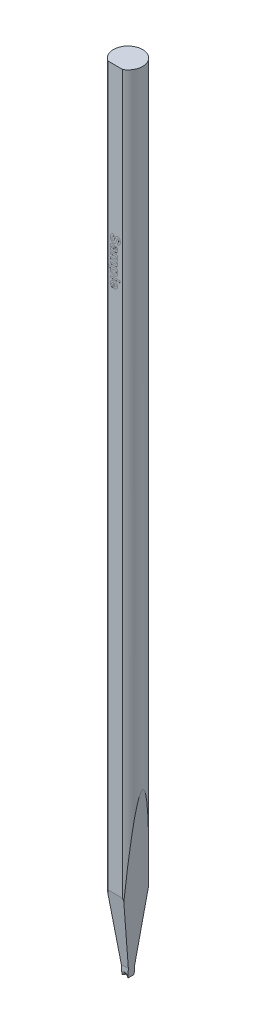
from build123d import *

# Parameters (mm, degrees)
SKETCH_TL_CUTTING_R       = 1.4986
TL_CUTTING_DEPTH          = 81.28
SKETCH_TDF_GRINDING_W     = 3.0172
SKETCH_TDF_GRINDING_H     = 3.0172
TDF_GRINDING_DEPTH        = 82.307625743
SKETCH_ENGRAVING_W        = 1
SKETCH_ENGRAVING_H        = 0.192307692
ENGRAVING_DEPTH           = 0.005
VW_VR_GRINDING_DEPTH      = 1.5086
VW_VR_GRINDING_DEPTH_BACK = 1.5086
ISA_GRINDING_DEPTH        = 1.5086
ISA_GRINDING_DEPTH_BACK   = 1.5086
PRE_FRX_BRX_DEPTH         = 1.5086
PRE_FRX_BRX_DEPTH_BACK    = 1.5086
SKETCH_PRE_FRX_BRX_W      = 1.18348
SKETCH_PRE_FRX_BRX_H      = 0.889
FR_EDM_R                  = 0.22606
BR_EDM_R                  = 0.22606
FA_BA_GRINDING_DEPTH      = 1.5086
FA_BA_GRINDING_DEPTH_BACK = 1.5086


with BuildPart() as part:
    # sketch_TL_cutting → TL_cutting (new body)
    with BuildSketch(Plane(origin=(0, 0, 0), x_dir=(1, 0, 0), z_dir=(0, 1, 0))):
        Circle(SKETCH_TL_CUTTING_R)
    extrude(amount=TL_CUTTING_DEPTH)

    # sketch_TDF_grinding → TDF_grinding (cut, through all)
    with BuildSketch(Plane(origin=(0, 0, 0), x_dir=(1, 0, 0), z_dir=(0, 1, 0))):
        with Locations((0, -2.804)):
            Rectangle(SKETCH_TDF_GRINDING_W, SKETCH_TDF_GRINDING_H)
    extrude(amount=TDF_GRINDING_DEPTH, mode=Mode.SUBTRACT)

    # sketch_engraving → engraving (cut)
    # profile 1 of 6: a face of its own
    with BuildSketch(Plane.XY.offset(1.2954)):
        with BuildLine():
            Line((-0.166666667, 66.228717949), (-0.153846154, 66.036410256))
            add(Edge.make_bspline(
                [(-0.153846154, 66.036410256), (-0.161891279, 66.034877607), (-0.177518424, 66.031900534), (-0.199795017, 66.025296625), (-0.220541784, 66.017990456), (-0.239662803, 66.009377579), (-0.25710555, 65.999512511), (-0.273156714, 65.988722233), (-0.28732832, 65.976479477), (-0.299925293, 65.963147792), (-0.310783278, 65.948574614), (-0.320246275, 65.932874014), (-0.328256178, 65.915952746), (-0.334922245, 65.897875434), (-0.339885492, 65.878462022), (-0.343420115, 65.857894378), (-0.345682646, 65.836139377), (-0.345994208, 65.821271711), (-0.346153846, 65.813653846)],
                knots=[0, 0, 0, 0, 1.20477517, 2.340199137, 3.415898527, 4.440826703, 5.422227366, 6.362763262, 7.28278988, 8.172822029, 9.057410505, 9.952475558, 10.866920142, 11.809098, 12.784128911, 13.811833846, 14.878831738, 16, 16, 16, 16], degree=3))
            add(Edge.make_bspline(
                [(-0.346153846, 65.813653846), (-0.346066367, 65.805635548), (-0.345896216, 65.790039545), (-0.343785338, 65.767439212), (-0.340761278, 65.746306874), (-0.335974263, 65.726829137), (-0.330620744, 65.708642273), (-0.323296559, 65.692197968), (-0.314849171, 65.677230114), (-0.305263574, 65.663777272), (-0.294632459, 65.652036964), (-0.28353392, 65.641765956), (-0.272207737, 65.632820587), (-0.260151301, 65.625779949), (-0.247852227, 65.620082055), (-0.234943611, 65.616316145), (-0.221721863, 65.613772051), (-0.212685699, 65.613480317), (-0.208133013, 65.613333333)],
                knots=[0, 0, 0, 0, 1.417779877, 2.757654889, 4.012140507, 5.189587551, 6.302846416, 7.360586765, 8.365575446, 9.33904572, 10.275781718, 11.161696098, 12.012180333, 12.822428111, 13.625933072, 14.403138519, 15.195454004, 16, 16, 16, 16], degree=3))
            add(Edge.make_bspline(
                [(-0.208133013, 65.613333333), (-0.202439146, 65.613627611), (-0.191320796, 65.614202244), (-0.175220679, 65.617972543), (-0.160658688, 65.624777047), (-0.147071392, 65.634013587), (-0.134926522, 65.646977985), (-0.123459543, 65.663382139), (-0.11316916, 65.683841853), (-0.107424402, 65.699010458), (-0.104366987, 65.707083333)],
                knots=[0, 0, 0, 0, 0.906150226, 1.7694295, 2.610923838, 3.450874087, 4.367551936, 5.419872502, 6.626831617, 8, 8, 8, 8], degree=3))
            add(Edge.make_bspline(
                [(-0.104366987, 65.707083333), (-0.103205903, 65.710547521), (-0.100607587, 65.718299809), (-0.096897182, 65.731525769), (-0.092218385, 65.747511172), (-0.087052561, 65.766404594), (-0.081545375, 65.7881675), (-0.074955523, 65.812593148), (-0.068334023, 65.840052448), (-0.063456004, 65.85926551), (-0.060897436, 65.869342949)],
                knots=[0, 0, 0, 0, 0.521824192, 1.167757792, 1.961731518, 2.901193269, 3.965386864, 5.168422915, 6.514810244, 8, 8, 8, 8], degree=3))
            add(Edge.make_bspline(
                [(-0.060897436, 65.869342949), (-0.0576208, 65.882466465), (-0.051299067, 65.907786143), (-0.040053153, 65.943897802), (-0.028879714, 65.9771573), (-0.016755933, 66.007244403), (-0.004503472, 66.034490983), (0.008737874, 66.058456319), (0.022280434, 66.079640515), (0.032402475, 66.091985038), (0.037259615, 66.097908654)],
                knots=[0, 0, 0, 0, 1.293880989, 2.496331788, 3.617634808, 4.64976062, 5.598842568, 6.473791081, 7.267636666, 8, 8, 8, 8], degree=3))
            add(Edge.make_bspline(
                [(0.037259615, 66.097908654), (0.044137694, 66.105254708), (0.057622804, 66.119657326), (0.079781426, 66.138616137), (0.103188466, 66.154546701), (0.127671148, 66.1676593), (0.153370416, 66.177755752), (0.180114252, 66.184911988), (0.207972454, 66.189543764), (0.22694455, 66.190016405), (0.236578526, 66.19025641)],
                knots=[0, 0, 0, 0, 1.064429417, 2.086912298, 3.078678339, 4.055528992, 5.020032834, 5.993708893, 6.981211098, 8, 8, 8, 8], degree=3))
            add(Edge.make_bspline(
                [(0.236578526, 66.19025641), (0.249044725, 66.189788947), (0.273773943, 66.188861639), (0.310123415, 66.180359285), (0.34519423, 66.167110895), (0.373053378, 66.151758506), (0.394102454, 66.136979981), (0.409316468, 66.124753329), (0.423234984, 66.111063515), (0.436363342, 66.096402084), (0.448421192, 66.080522948), (0.459337354, 66.063406575), (0.469762031, 66.04537482), (0.481724432, 66.019062443), (0.494501972, 65.983531575), (0.505216674, 65.937296526), (0.511620444, 65.886950752), (0.512410831, 65.852001491), (0.512820513, 65.833886218)],
                knots=[0, 0, 0, 0, 1.180224575, 2.341213254, 3.519178081, 4.726056898, 5.344182394, 5.956118988, 6.573855441, 7.192564044, 7.82049682, 8.461345463, 9.116141012, 9.79299132, 11.198532007, 12.687823846, 14.283197644, 16, 16, 16, 16], degree=3))
            add(Edge.make_bspline(
                [(0.512820513, 65.833886218), (0.512622915, 65.819053184), (0.512238592, 65.79020325), (0.508327094, 65.748385277), (0.502300976, 65.709376936), (0.493471523, 65.67324209), (0.482080613, 65.639912702), (0.468307987, 65.609323819), (0.4520288, 65.58155582), (0.433078398, 65.556903847), (0.412189308, 65.534940609), (0.389371716, 65.515781372), (0.364914548, 65.49935264), (0.338835479, 65.485548448), (0.311000478, 65.47470805), (0.281444264, 65.466746206), (0.250236407, 65.461480173), (0.228852471, 65.460160226), (0.217948718, 65.459487179)],
                knots=[0, 0, 0, 0, 1.325136797, 2.577362738, 3.74962816, 4.849499017, 5.896771726, 6.892816139, 7.842473141, 8.766187929, 9.665133525, 10.546015357, 11.42313021, 12.293255665, 13.177485873, 14.086514152, 15.024305989, 16, 16, 16, 16], degree=3))
            Line((0.217948718, 65.459487179), (0.205128205, 65.651794872))
            add(Edge.make_bspline(
                [(0.205128205, 65.651794872), (0.211158714, 65.652903797), (0.22291155, 65.655064976), (0.239739753, 65.659772083), (0.255319488, 65.66505285), (0.269550394, 65.67131916), (0.282452554, 65.678537492), (0.29405422, 65.686741672), (0.304442868, 65.695777543), (0.313348905, 65.706026012), (0.321255295, 65.717250185), (0.327770309, 65.729876673), (0.333732615, 65.7435148), (0.338229411, 65.758675772), (0.341791978, 65.775084625), (0.344434282, 65.792746154), (0.34572413, 65.811698367), (0.346007328, 65.824736733), (0.346153846, 65.831482372)],
                knots=[0, 0, 0, 0, 1.150775252, 2.242741279, 3.277646382, 4.23752694, 5.158201782, 6.048759188, 6.901533576, 7.736611693, 8.592238639, 9.472855288, 10.399741491, 11.383322377, 12.435924598, 13.551250831, 14.733094547, 16, 16, 16, 16], degree=3))
            add(Edge.make_bspline(
                [(0.346153846, 65.831482372), (0.346024502, 65.838495999), (0.345772856, 65.852141324), (0.344228543, 65.8720262), (0.34137789, 65.890679706), (0.337667048, 65.908193454), (0.332618703, 65.924544049), (0.326463073, 65.939696989), (0.319216002, 65.953721597), (0.313514257, 65.962273191), (0.310697115, 65.966498397)],
                knots=[0, 0, 0, 0, 1.186678824, 2.308736671, 3.37120409, 4.377216403, 5.334874112, 6.262130804, 7.141346615, 8, 8, 8, 8], degree=3))
            add(Edge.make_bspline(
                [(0.310697115, 65.966498397), (0.30684882, 65.971333791), (0.299395868, 65.980698448), (0.284596838, 65.9907768), (0.267881777, 65.996843991), (0.256061421, 65.997574247), (0.25, 65.997948718)],
                knots=[0, 0, 0, 0, 1.037857257, 2.010007357, 2.979541333, 4, 4, 4, 4], degree=3))
            add(Edge.make_bspline(
                [(0.25, 65.997948718), (0.244335199, 65.997642469), (0.233176443, 65.997039206), (0.217325189, 65.990954527), (0.202637862, 65.98159712), (0.194659513, 65.972854158), (0.190504808, 65.968301282)],
                knots=[0, 0, 0, 0, 0.98538058, 1.941042925, 2.927803204, 4, 4, 4, 4], degree=3))
            add(Edge.make_bspline(
                [(0.190504808, 65.968301282), (0.187808196, 65.964687988), (0.18178239, 65.956613781), (0.17412302, 65.941823434), (0.165827461, 65.923971096), (0.157717635, 65.902649778), (0.149622864, 65.878001181), (0.141170987, 65.850023806), (0.132605635, 65.818700446), (0.124310512, 65.784829517), (0.116156882, 65.750440984), (0.107242663, 65.717624955), (0.098551989, 65.687110767), (0.089442753, 65.659039906), (0.080574939, 65.633267671), (0.071467056, 65.609919256), (0.062596997, 65.58883434), (0.050400038, 65.564246991), (0.033878763, 65.536379703), (0.009862335, 65.507171642), (-0.017133698, 65.48134084), (-0.042589095, 65.463342623), (-0.064481415, 65.450978789), (-0.081932142, 65.443017785), (-0.100320809, 65.436130892), (-0.119667735, 65.43052498), (-0.140000145, 65.426462043), (-0.161162698, 65.423099726), (-0.183331155, 65.421381856), (-0.198448465, 65.421145657), (-0.206129808, 65.421025641)],
                knots=[0, 0, 0, 0, 0.511875881, 1.143829537, 1.88775736, 2.750598373, 3.734912702, 4.837306479, 6.073130119, 7.42648979, 8.801963576, 10.091065733, 11.292408984, 12.408830014, 13.446061236, 14.39066453, 15.257936293, 16.045629259, 17.510392066, 18.929669597, 20.331293837, 21.746891395, 22.460690638, 23.187651344, 23.925159671, 24.69163991, 25.474819891, 26.281170188, 27.126635539, 28, 28, 28, 28], degree=3))
            add(Edge.make_bspline(
                [(-0.206129808, 65.421025641), (-0.213213723, 65.421190667), (-0.227281693, 65.421518393), (-0.248162112, 65.42380863), (-0.268671734, 65.427350423), (-0.288836268, 65.432593495), (-0.308616053, 65.439548961), (-0.328296541, 65.447380279), (-0.347448635, 65.45717284), (-0.366087841, 65.468318337), (-0.384201522, 65.48061148), (-0.400907086, 65.494545053), (-0.416780552, 65.509286381), (-0.430830184, 65.525791492), (-0.444499814, 65.542874729), (-0.456413626, 65.561651015), (-0.467267368, 65.581519569), (-0.476944445, 65.602661493), (-0.485241283, 65.625146826), (-0.492760445, 65.648840495), (-0.498861937, 65.67396603), (-0.504102567, 65.700352968), (-0.508085093, 65.728103742), (-0.510866581, 65.757181988), (-0.512434986, 65.787594789), (-0.512690407, 65.80831022), (-0.512820513, 65.818862179)],
                knots=[0, 0, 0, 0, 0.900523777, 1.788352984, 2.667658312, 3.544829998, 4.433470602, 5.332071549, 6.235671317, 7.16456001, 8.092361829, 9.015217829, 9.927983376, 10.842405559, 11.767913001, 12.707486241, 13.664840466, 14.644960138, 15.660436429, 16.710285012, 17.80361473, 18.945755434, 20.129541241, 21.366238063, 22.658422763, 24, 24, 24, 24], degree=3))
            add(Edge.make_bspline(
                [(-0.512820513, 65.818862179), (-0.512571769, 65.834097584), (-0.512087459, 65.863761277), (-0.507752501, 65.906857296), (-0.501117535, 65.947278506), (-0.491487967, 65.98495912), (-0.47912575, 66.019945132), (-0.463898318, 66.052220803), (-0.445714308, 66.081629249), (-0.4250161, 66.108537493), (-0.401421388, 66.132576838), (-0.37543806, 66.154222472), (-0.346733609, 66.173055309), (-0.315676999, 66.189585327), (-0.28185988, 66.203074186), (-0.245840091, 66.214602175), (-0.207125792, 66.223178959), (-0.180386288, 66.226839687), (-0.166666667, 66.228717949)],
                knots=[0, 0, 0, 0, 1.217919187, 2.371317543, 3.459749122, 4.490553404, 5.476795534, 6.422548752, 7.338285933, 8.236452553, 9.131296239, 10.026155855, 10.935394819, 11.871650654, 12.834387429, 13.842485342, 14.893012909, 16, 16, 16, 16], degree=3))
        make_face()
    # profile 2 of 6: a face of its own
    with BuildSketch(Plane.XY.offset(1.2954)):
        with BuildLine():
            Line((0.012820513, 65.126153846), (0.038461538, 65.292820513))
            add(Edge.make_bspline(
                [(0.038461538, 65.292820513), (0.046909054, 65.290322773), (0.063444893, 65.285433497), (0.0871409, 65.276461597), (0.109047839, 65.265955594), (0.129427422, 65.254368962), (0.148056862, 65.241344679), (0.164984622, 65.227090911), (0.180152765, 65.211527103), (0.19367872, 65.194578871), (0.205694353, 65.17592015), (0.215881219, 65.155127383), (0.224458705, 65.132231732), (0.231351998, 65.107265345), (0.237115058, 65.080270108), (0.240643117, 65.051039394), (0.243189827, 65.019761739), (0.243453822, 64.99822163), (0.243589744, 64.98713141)],
                knots=[0, 0, 0, 0, 1.047140172, 2.049755565, 3.008539736, 3.933190086, 4.833981818, 5.707167246, 6.560530269, 7.413560864, 8.281243119, 9.193714071, 10.161006392, 11.183910126, 12.270717139, 13.439589873, 14.681737877, 16, 16, 16, 16], degree=3))
            add(Edge.make_bspline(
                [(0.243589744, 64.98713141), (0.243534228, 64.977046723), (0.243426815, 64.957534437), (0.242000124, 64.92926808), (0.239698922, 64.903054289), (0.236188636, 64.878814358), (0.232169239, 64.856495802), (0.226945807, 64.836146141), (0.220823169, 64.817813075), (0.211299506, 64.796630462), (0.197913915, 64.773367886), (0.179756247, 64.74906565), (0.159013578, 64.729617094), (0.139821698, 64.716528755), (0.122335675, 64.708827836), (0.106814059, 64.703855466), (0.088956248, 64.699474221), (0.068502887, 64.69624198), (0.045803313, 64.693340808), (0.020516352, 64.691733811), (-0.007131366, 64.690443155), (-0.026440401, 64.690320201), (-0.036458333, 64.69025641)],
                knots=[0, 0, 0, 0, 1.253089278, 2.424530831, 3.516103812, 4.521791402, 5.467348922, 6.332758186, 7.130477226, 7.865998692, 9.215316109, 10.458392318, 11.620687606, 12.7345829, 13.32519123, 13.989073223, 14.757870489, 15.607744835, 16.560809343, 17.600728964, 18.755207866, 20, 20, 20, 20], degree=3))
            Line((-0.036458333, 64.69025641), (-0.261017628, 64.69025641))
            add(Edge.make_bspline(
                [(-0.261017628, 64.69025641), (-0.26876291, 64.690191106), (-0.283720285, 64.690064994), (-0.305369916, 64.689858726), (-0.325384127, 64.68860567), (-0.343848542, 64.687883727), (-0.360723997, 64.686104895), (-0.3760468, 64.684451041), (-0.389817284, 64.68223103), (-0.406271816, 64.678727434), (-0.426174196, 64.672982854), (-0.450246687, 64.664096636), (-0.475006195, 64.652613939), (-0.491503263, 64.643611185), (-0.5, 64.638974359)],
                knots=[0, 0, 0, 0, 1.124133555, 2.170881208, 3.141136401, 4.03397314, 4.851653906, 5.602897914, 6.270414243, 6.874806075, 8.043499627, 9.272964875, 10.595453442, 12, 12, 12, 12], degree=3))
            Line((-0.5, 64.638974359), (-0.5, 64.831282051))
            add(Edge.make_bspline(
                [(-0.5, 64.831282051), (-0.496139139, 64.832654663), (-0.487679201, 64.835662336), (-0.473498086, 64.839724209), (-0.456975369, 64.844592099), (-0.445053008, 64.847801538), (-0.438701923, 64.849511218)],
                knots=[0, 0, 0, 0, 0.768508203, 1.683958961, 2.766236402, 4, 4, 4, 4], degree=3))
            add(Edge.make_bspline(
                [(-0.438701923, 64.849511218), (-0.435886901, 64.850208108), (-0.430774033, 64.851473855), (-0.423993811, 64.853691297), (-0.418613075, 64.854860943), (-0.415659063, 64.855901037), (-0.414463141, 64.856322115)],
                knots=[0, 0, 0, 0, 1.38134116, 2.508902287, 3.396334264, 4, 4, 4, 4], degree=3))
            add(Edge.make_bspline(
                [(-0.414463141, 64.856322115), (-0.422306637, 64.864457559), (-0.437655041, 64.880377254), (-0.457532204, 64.906341122), (-0.474646093, 64.932866544), (-0.488605327, 64.960386904), (-0.499566193, 64.988746676), (-0.507080988, 65.018140575), (-0.511891829, 65.048405165), (-0.512508639, 65.068910725), (-0.512820513, 65.079278846)],
                knots=[0, 0, 0, 0, 1.082278699, 2.117837564, 3.127951196, 4.103896207, 5.070141411, 6.035602179, 7.006751569, 8, 8, 8, 8], degree=3))
            add(Edge.make_bspline(
                [(-0.512820513, 65.079278846), (-0.512611735, 65.08829889), (-0.51220396, 65.105916381), (-0.50951013, 65.131624012), (-0.504401451, 65.155789166), (-0.497605711, 65.178521026), (-0.489067093, 65.199880039), (-0.478321262, 65.219662593), (-0.465716244, 65.23801315), (-0.450989615, 65.25454154), (-0.435073542, 65.269551608), (-0.417958735, 65.282644355), (-0.399800554, 65.293800397), (-0.380541476, 65.302748564), (-0.360298141, 65.309888733), (-0.339064305, 65.314796291), (-0.316799924, 65.317929124), (-0.301626775, 65.318281435), (-0.293870192, 65.318461538)],
                knots=[0, 0, 0, 0, 1.18658458, 2.31757657, 3.394226474, 4.430715881, 5.435456892, 6.414057866, 7.386212409, 8.35709637, 9.320281587, 10.260156395, 11.186596348, 12.117853754, 13.048448167, 14.005042754, 14.980168739, 16, 16, 16, 16], degree=3))
            add(Edge.make_bspline(
                [(-0.293870192, 65.318461538), (-0.283700577, 65.31810511), (-0.263757923, 65.317406153), (-0.234652538, 65.312208551), (-0.207362153, 65.303020466), (-0.181862262, 65.290629198), (-0.158596875, 65.27506418), (-0.138063167, 65.256372743), (-0.120502285, 65.234769213), (-0.105770222, 65.2096943), (-0.093232389, 65.180477431), (-0.081107706, 65.146412551), (-0.070353555, 65.106569614), (-0.064168165, 65.077973636), (-0.060897436, 65.062852564)],
                knots=[0, 0, 0, 0, 0.956565251, 1.875828012, 2.769799286, 3.657635185, 4.535794535, 5.394066738, 6.260416921, 7.14495727, 8.120882861, 9.247498621, 10.544523601, 12, 12, 12, 12], degree=3))
            add(Edge.make_bspline(
                [(-0.060897436, 65.062852564), (-0.058777918, 65.052432311), (-0.054697922, 65.032373691), (-0.048550502, 65.003563846), (-0.042415315, 64.977294761), (-0.036019644, 64.953603672), (-0.030418943, 64.932204546), (-0.024623629, 64.913353208), (-0.018838679, 64.897055523), (-0.014727786, 64.887156714), (-0.012820513, 64.882564103)],
                knots=[0, 0, 0, 0, 1.365617471, 2.628765604, 3.783168753, 4.829402825, 5.780074121, 6.623651276, 7.361434847, 8, 8, 8, 8], degree=3))
            Line((-0.012820513, 64.882564103), (0.005408654, 64.882564103))
            add(Edge.make_bspline(
                [(0.005408654, 64.882564103), (0.013579622, 64.88282195), (0.028753575, 64.883300787), (0.049815104, 64.888012783), (0.067054204, 64.896267499), (0.078735074, 64.905966174), (0.085649046, 64.915766975), (0.090345699, 64.924467914), (0.093950934, 64.934721013), (0.097287101, 64.946260364), (0.0995171, 64.959301833), (0.101382359, 64.973729797), (0.102294697, 64.98959078), (0.102471846, 65.000618931), (0.102564103, 65.006362179)],
                knots=[0, 0, 0, 0, 1.600017626, 2.971323677, 4.194571328, 5.31736933, 5.898517236, 6.536691297, 7.248930295, 8.023708211, 8.888724419, 9.83830628, 10.874231527, 12, 12, 12, 12], degree=3))
            add(Edge.make_bspline(
                [(0.102564103, 65.006362179), (0.102372886, 65.013991824), (0.102007879, 65.02855582), (0.098228604, 65.049020653), (0.092028517, 65.066964405), (0.083011553, 65.082505158), (0.070677976, 65.095940445), (0.054784235, 65.107641921), (0.03524962, 65.118007335), (0.020578142, 65.123336186), (0.012820513, 65.126153846)],
                knots=[0, 0, 0, 0, 1.120624541, 2.139125895, 3.045753857, 3.899333821, 4.761059621, 5.707367731, 6.787757473, 8, 8, 8, 8], degree=3))
        make_face()
        with BuildLine():
            add(Edge.make_bspline(
                [(-0.153846154, 64.882564103), (-0.155885143, 64.889164138), (-0.16047749, 64.904029178), (-0.167188394, 64.928940204), (-0.174366647, 64.958953522), (-0.180456821, 64.986656294), (-0.185514697, 65.009876191), (-0.189475935, 65.026252939), (-0.193539681, 65.040999709), (-0.197441348, 65.054126554), (-0.201486639, 65.065681533), (-0.205463261, 65.075551125), (-0.209129994, 65.08400598), (-0.212150439, 65.088724204), (-0.213541667, 65.090897436)],
                knots=[0, 0, 0, 0, 1.144251806, 2.577159925, 4.272729571, 6.25595871, 7.275767821, 8.209390473, 9.046628288, 9.809462825, 10.477647263, 11.07332096, 11.573168194, 12, 12, 12, 12], degree=3))
            add(Edge.make_bspline(
                [(-0.213541667, 65.090897436), (-0.217777869, 65.096276024), (-0.225907663, 65.106598198), (-0.241618317, 65.117850564), (-0.259035906, 65.124990897), (-0.271365501, 65.12576145), (-0.277644231, 65.126153846)],
                knots=[0, 0, 0, 0, 1.075028234, 2.063111864, 3.013658082, 4, 4, 4, 4], degree=3))
            add(Edge.make_bspline(
                [(-0.277644231, 65.126153846), (-0.283891387, 65.12580773), (-0.296145658, 65.125128798), (-0.31380435, 65.1197217), (-0.329979349, 65.110627478), (-0.344370894, 65.098247385), (-0.356745621, 65.083373769), (-0.365439774, 65.065879161), (-0.370822638, 65.046475583), (-0.371463572, 65.032840996), (-0.371794872, 65.025793269)],
                knots=[0, 0, 0, 0, 0.97671936, 1.915908908, 2.861187175, 3.862381481, 4.872972798, 5.868749731, 6.898355403, 8, 8, 8, 8], degree=3))
            add(Edge.make_bspline(
                [(-0.371794872, 65.025793269), (-0.37143029, 65.017735914), (-0.370696317, 65.001514937), (-0.363990016, 64.977724736), (-0.354091612, 64.954236416), (-0.344349902, 64.939974458), (-0.339342949, 64.932644231)],
                knots=[0, 0, 0, 0, 0.962503947, 1.937702252, 2.940039444, 4, 4, 4, 4], degree=3))
            add(Edge.make_bspline(
                [(-0.339342949, 64.932644231), (-0.335175233, 64.927467353), (-0.32707178, 64.917401747), (-0.312263496, 64.905404959), (-0.296511013, 64.89550495), (-0.284890152, 64.891559389), (-0.279046474, 64.889575321)],
                knots=[0, 0, 0, 0, 1.055399509, 2.052054707, 3.020454315, 4, 4, 4, 4], degree=3))
            add(Edge.make_bspline(
                [(-0.279046474, 64.889575321), (-0.274254264, 64.888481826), (-0.263036327, 64.885922099), (-0.243287652, 64.884116149), (-0.218440013, 64.88265525), (-0.200124236, 64.882596334), (-0.190104167, 64.882564103)],
                knots=[0, 0, 0, 0, 0.659054705, 1.542760655, 2.655710416, 4, 4, 4, 4], degree=3))
            Line((-0.190104167, 64.882564103), (-0.153846154, 64.882564103))
        make_face(mode=Mode.SUBTRACT)
    # profile 3 of 6: a face of its own
    with BuildSketch(Plane.XY.offset(1.2954)):
        with BuildLine():
            Line((0.230769231, 64.510769231), (0.230769231, 64.318461538))
            Line((0.230769231, 64.318461538), (0.1328125, 64.318461538))
            add(Edge.make_bspline(
                [(0.1328125, 64.318461538), (0.141664699, 64.310897511), (0.158931351, 64.296143499), (0.181382685, 64.271462251), (0.200586186, 64.2459552), (0.21644089, 64.21937127), (0.228531159, 64.191472579), (0.237134296, 64.162485336), (0.242539521, 64.13243041), (0.243237377, 64.112020357), (0.243589744, 64.101714744)],
                knots=[0, 0, 0, 0, 1.107940857, 2.161093632, 3.169644562, 4.144639019, 5.101548547, 6.057210626, 7.019030711, 8, 8, 8, 8], degree=3))
            add(Edge.make_bspline(
                [(0.243589744, 64.101714744), (0.243215794, 64.090948495), (0.242486901, 64.069963206), (0.237632212, 64.039505651), (0.228624904, 64.01142895), (0.216596826, 63.985473491), (0.200997643, 63.961725385), (0.181697421, 63.940341944), (0.1589088, 63.921109403), (0.141647297, 63.910586276), (0.1328125, 63.905200321)],
                knots=[0, 0, 0, 0, 1.087442074, 2.119613481, 3.102840357, 4.056171906, 5.000733146, 5.960649063, 6.95621775, 8, 8, 8, 8], degree=3))
            add(Edge.make_bspline(
                [(0.1328125, 63.905200321), (0.141648331, 63.897280271), (0.15890459, 63.881812522), (0.18160607, 63.856450997), (0.200837622, 63.830127047), (0.216342266, 63.802724069), (0.228440547, 63.774425033), (0.237463475, 63.745274977), (0.242455792, 63.714933774), (0.243209151, 63.694413285), (0.243589744, 63.684046474)],
                knots=[0, 0, 0, 0, 1.113355786, 2.174368662, 3.188819075, 4.168565139, 5.12342631, 6.073356391, 7.026672896, 8, 8, 8, 8], degree=3))
            add(Edge.make_bspline(
                [(0.243589744, 63.684046474), (0.243253707, 63.671264411), (0.242603687, 63.64653916), (0.236233833, 63.610990396), (0.226092646, 63.578384669), (0.211825029, 63.548909889), (0.193628332, 63.522613111), (0.171312748, 63.500075383), (0.145297956, 63.480737741), (0.125650654, 63.471322182), (0.115584936, 63.466498397)],
                knots=[0, 0, 0, 0, 1.140905914, 2.206935121, 3.214358517, 4.182792527, 5.121068659, 6.057503675, 7.004819049, 8, 8, 8, 8], degree=3))
            add(Edge.make_bspline(
                [(0.115584936, 63.466498397), (0.1114006, 63.464896604), (0.102614163, 63.461533095), (0.088193677, 63.457579062), (0.07205936, 63.454256297), (0.05407705, 63.451438692), (0.034354022, 63.449322459), (0.012779717, 63.447648455), (-0.010546601, 63.44699832), (-0.026709385, 63.446779611), (-0.03505609, 63.446666667)],
                knots=[0, 0, 0, 0, 0.70348757, 1.477211565, 2.345356006, 3.290383569, 4.335215205, 5.460703428, 6.68866909, 8, 8, 8, 8], degree=3))
            Line((-0.03505609, 63.446666667), (-0.5, 63.446666667))
            Line((-0.5, 63.446666667), (-0.5, 63.638974359))
            Line((-0.5, 63.638974359), (-0.080128205, 63.638974359))
            add(Edge.make_bspline(
                [(-0.080128205, 63.638974359), (-0.07144761, 63.639086396), (-0.054817384, 63.639301037), (-0.031090468, 63.639945192), (-0.009777274, 63.641583104), (0.009076857, 63.643724828), (0.025551617, 63.646457511), (0.039613136, 63.649833558), (0.051411557, 63.653627728), (0.058064109, 63.657184264), (0.061097756, 63.65880609)],
                knots=[0, 0, 0, 0, 1.448583407, 2.775186282, 3.959557885, 5.014017743, 5.940851432, 6.743435621, 7.42699079, 8, 8, 8, 8], degree=3))
            add(Edge.make_bspline(
                [(0.061097756, 63.65880609), (0.0644449, 63.661046703), (0.071015994, 63.665445463), (0.079428524, 63.673581971), (0.086594396, 63.682526034), (0.092366124, 63.692410543), (0.097066603, 63.703069139), (0.100204228, 63.714687303), (0.10230955, 63.727171978), (0.102477414, 63.735853298), (0.102564103, 63.740336538)],
                knots=[0, 0, 0, 0, 1.007330723, 1.977586358, 2.91811154, 3.870610884, 4.837109745, 5.827490497, 6.87806446, 8, 8, 8, 8], degree=3))
            add(Edge.make_bspline(
                [(0.102564103, 63.740336538), (0.102240034, 63.746972111), (0.101593875, 63.760202775), (0.09685111, 63.779660701), (0.088810593, 63.798387428), (0.077873982, 63.816238407), (0.064089543, 63.832877276), (0.046951113, 63.846953185), (0.027058253, 63.858722569), (0.008201325, 63.866104518), (-0.008714124, 63.87081352), (-0.023370098, 63.873967347), (-0.039736185, 63.876768488), (-0.057919723, 63.878964673), (-0.07777632, 63.880456881), (-0.09941442, 63.881666157), (-0.122723067, 63.882512129), (-0.138888099, 63.882546404), (-0.147235577, 63.882564103)],
                knots=[0, 0, 0, 0, 0.980909897, 1.955835539, 2.942693402, 3.98436442, 5.042755257, 6.12263035, 7.247279534, 8.448501813, 9.105087946, 9.843148781, 10.66469806, 11.560151265, 12.550905382, 13.609296218, 14.765461946, 16, 16, 16, 16], degree=3))
            Line((-0.147235577, 63.882564103), (-0.5, 63.882564103))
            Line((-0.5, 63.882564103), (-0.5, 64.074871795))
            Line((-0.5, 64.074871795), (-0.097355769, 64.074871795))
            add(Edge.make_bspline(
                [(-0.097355769, 64.074871795), (-0.088808683, 64.074926135), (-0.072514885, 64.075029726), (-0.049272866, 64.075370876), (-0.028431625, 64.076137425), (-0.010001412, 64.077354799), (0.006094573, 64.078757797), (0.019817647, 64.080232173), (0.031211059, 64.082185261), (0.042972639, 64.085301362), (0.055281064, 64.090213036), (0.068015353, 64.097443829), (0.078952496, 64.105913541), (0.087734398, 64.116130961), (0.094431133, 64.128066292), (0.099289836, 64.141728729), (0.101996826, 64.157298124), (0.102369061, 64.168277531), (0.102564103, 64.174030449)],
                knots=[0, 0, 0, 0, 1.59941463, 3.049055322, 4.349500855, 5.501487129, 6.504910079, 7.372843676, 8.083634967, 8.665560774, 9.647038445, 10.55368294, 11.398647399, 12.222657519, 13.056461931, 13.945719492, 14.92361148, 16, 16, 16, 16], degree=3))
            add(Edge.make_bspline(
                [(0.102564103, 64.174030449), (0.102234348, 64.181196829), (0.101586917, 64.195267082), (0.097099356, 64.215860655), (0.089385598, 64.235235661), (0.078745529, 64.253299036), (0.065308531, 64.269702826), (0.048811546, 64.28360159), (0.02977557, 64.295138856), (0.011740073, 64.30242889), (-0.004479026, 64.307158642), (-0.018770373, 64.310049471), (-0.034874654, 64.312649694), (-0.052844538, 64.314858981), (-0.072766981, 64.316377908), (-0.094540599, 64.31755338), (-0.118182385, 64.31841378), (-0.134547779, 64.318445237), (-0.143028846, 64.318461538)],
                knots=[0, 0, 0, 0, 1.061105177, 2.08334182, 3.104381884, 4.137278018, 5.176827868, 6.229094397, 7.316239487, 8.460364206, 9.09881589, 9.816452537, 10.617971519, 11.514628853, 12.496857794, 13.576419947, 14.74402393, 16, 16, 16, 16], degree=3))
            Line((-0.143028846, 64.318461538), (-0.5, 64.318461538))
            Line((-0.5, 64.318461538), (-0.5, 64.510769231))
            Line((-0.5, 64.510769231), (0.230769231, 64.510769231))
        make_face()
    # profile 4 of 6: a face of its own
    with BuildSketch(Plane.XY.offset(1.2954)):
        with BuildLine():
            Line((0.230769231, 63.254358974), (0.230769231, 63.062051282))
            Line((0.230769231, 63.062051282), (0.125400641, 63.062051282))
            add(Edge.make_bspline(
                [(0.125400641, 63.062051282), (0.134110558, 63.056328192), (0.151482958, 63.04491318), (0.174623276, 63.02385835), (0.194727471, 62.999718206), (0.21216262, 62.973179417), (0.226252501, 62.944345376), (0.236247247, 62.913671975), (0.242498657, 62.881481858), (0.243222023, 62.859489189), (0.243589744, 62.848309295)],
                knots=[0, 0, 0, 0, 0.978547196, 1.95176541, 2.927409496, 3.924956672, 4.929940552, 5.934297003, 6.949907262, 8, 8, 8, 8], degree=3))
            add(Edge.make_bspline(
                [(0.243589744, 62.848309295), (0.243275199, 62.838541821), (0.242653327, 62.819231017), (0.237904657, 62.790874643), (0.230300531, 62.763557527), (0.219424348, 62.737376502), (0.205256392, 62.712439427), (0.188112758, 62.688677123), (0.167850875, 62.666116128), (0.144791975, 62.644820256), (0.118886648, 62.625323008), (0.090438984, 62.608285417), (0.059420431, 62.594050634), (0.02614289, 62.582152555), (-0.00973483, 62.573328479), (-0.047865347, 62.566627494), (-0.088468702, 62.562921584), (-0.116312431, 62.562346541), (-0.130608974, 62.562051282)],
                knots=[0, 0, 0, 0, 0.889183518, 1.757962001, 2.610823862, 3.466866804, 4.332788647, 5.217155532, 6.130223362, 7.089913047, 8.071415563, 9.077827182, 10.103546864, 11.174887114, 12.291391641, 13.464112916, 14.69793237, 16, 16, 16, 16], degree=3))
            add(Edge.make_bspline(
                [(-0.130608974, 62.562051282), (-0.145309675, 62.562315908), (-0.173899782, 62.562830556), (-0.215458383, 62.566940588), (-0.254585771, 62.573314968), (-0.291083626, 62.583120651), (-0.325347568, 62.594933416), (-0.356921697, 62.609865855), (-0.386073852, 62.627339567), (-0.412336985, 62.6475977), (-0.435948519, 62.669531194), (-0.456547424, 62.692845565), (-0.473866574, 62.71737144), (-0.488041441, 62.743039276), (-0.499108447, 62.769855372), (-0.507216556, 62.797768366), (-0.511869709, 62.826919211), (-0.512500462, 62.846690556), (-0.512820513, 62.856722756)],
                knots=[0, 0, 0, 0, 1.306276956, 2.54046374, 3.708317787, 4.825351227, 5.895229917, 6.925275359, 7.923721025, 8.910100439, 9.867470588, 10.784172372, 11.670002506, 12.530604141, 13.384735846, 14.243124713, 15.108541968, 16, 16, 16, 16], degree=3))
            add(Edge.make_bspline(
                [(-0.512820513, 62.856722756), (-0.512609167, 62.866228647), (-0.512194245, 62.88489093), (-0.507198627, 62.912096366), (-0.500287281, 62.938126612), (-0.489449809, 62.96297979), (-0.475076841, 62.987355706), (-0.456848814, 63.012131713), (-0.434276455, 63.037369377), (-0.417064851, 63.053569123), (-0.408052885, 63.062051282)],
                knots=[0, 0, 0, 0, 0.955822701, 1.876503125, 2.776905967, 3.662325514, 4.596312032, 5.620965962, 6.754341905, 8, 8, 8, 8], degree=3))
            Line((-0.408052885, 63.062051282), (-0.769230769, 63.062051282))
            Line((-0.769230769, 63.062051282), (-0.769230769, 63.254358974))
            Line((-0.769230769, 63.254358974), (0.230769231, 63.254358974))
        make_face()
        with BuildLine():
            add(Edge.make_bspline(
                [(-0.122195513, 63.062051282), (-0.132481435, 63.061869399), (-0.152405274, 63.061517092), (-0.181244648, 63.0596158), (-0.208037309, 63.056085347), (-0.232684253, 63.050774209), (-0.255441334, 63.044588635), (-0.275988928, 63.036469266), (-0.294539024, 63.027160628), (-0.310824186, 63.016236628), (-0.325130191, 63.004357295), (-0.337524496, 62.991785976), (-0.348144327, 62.978613898), (-0.356821345, 62.964788021), (-0.363446941, 62.950207774), (-0.368372821, 62.93504583), (-0.371163803, 62.919191699), (-0.371583715, 62.908415646), (-0.371794872, 62.902996795)],
                knots=[0, 0, 0, 0, 1.493314022, 2.892550594, 4.193549699, 5.412205958, 6.550654332, 7.612709232, 8.614154521, 9.557822924, 10.452682187, 11.309508678, 12.116407821, 12.904513946, 13.672267114, 14.435601522, 15.213325928, 16, 16, 16, 16], degree=3))
            add(Edge.make_bspline(
                [(-0.371794872, 62.902996795), (-0.371659076, 62.897777458), (-0.371390934, 62.88747138), (-0.368717534, 62.87238879), (-0.36428733, 62.857978562), (-0.35796517, 62.844320696), (-0.350180339, 62.83118585), (-0.340400371, 62.818874137), (-0.328879204, 62.80732573), (-0.315890023, 62.796060335), (-0.300495775, 62.786347266), (-0.283066961, 62.777655169), (-0.26342759, 62.770240806), (-0.241425455, 62.764598273), (-0.21727146, 62.759992165), (-0.190916328, 62.756647541), (-0.162291664, 62.754622487), (-0.142498204, 62.754449089), (-0.132211538, 62.754358974)],
                knots=[0, 0, 0, 0, 0.791436533, 1.562766886, 2.315979036, 3.073269983, 3.841398674, 4.627954771, 5.451998839, 6.314818792, 7.231140921, 8.205467689, 9.266952699, 10.409907015, 11.648037837, 12.996681567, 14.439174734, 16, 16, 16, 16], degree=3))
            add(Edge.make_bspline(
                [(-0.132211538, 62.754358974), (-0.122590159, 62.754424206), (-0.103987384, 62.754550329), (-0.077055352, 62.756934923), (-0.051997139, 62.760142066), (-0.028873936, 62.765056593), (-0.007518455, 62.770845012), (0.01172948, 62.77855908), (0.029199081, 62.787330952), (0.044606747, 62.797634518), (0.058319539, 62.808764437), (0.069887203, 62.820950097), (0.080128065, 62.833373302), (0.08840061, 62.846618471), (0.094621072, 62.860689896), (0.099305551, 62.875235213), (0.101912651, 62.890551976), (0.102344136, 62.900917634), (0.102564103, 62.906201923)],
                knots=[0, 0, 0, 0, 1.476459806, 2.854710082, 4.147877, 5.352136794, 6.481419541, 7.539804139, 8.530071065, 9.476830027, 10.379846701, 11.23529603, 12.051777807, 12.848258948, 13.623682229, 14.408266492, 15.188553102, 16, 16, 16, 16], degree=3))
            add(Edge.make_bspline(
                [(0.102564103, 62.906201923), (0.102455308, 62.911692144), (0.102241498, 62.922481924), (0.099201363, 62.938244161), (0.094853437, 62.953393305), (0.088686029, 62.967855544), (0.080452533, 62.981364223), (0.070807323, 62.994386207), (0.059117992, 63.00648559), (0.045859614, 63.017998235), (0.030812699, 63.028454665), (0.01390315, 63.037434633), (-0.00466452, 63.044978908), (-0.024767533, 63.051509579), (-0.046730612, 63.056208148), (-0.070369893, 63.059483429), (-0.095705859, 63.061854034), (-0.113175154, 63.061984114), (-0.122195513, 63.062051282)],
                knots=[0, 0, 0, 0, 0.85812159, 1.686442648, 2.503408574, 3.322778131, 4.138405645, 4.97460315, 5.854412976, 6.765937777, 7.719865152, 8.715925653, 9.756353289, 10.85381274, 12.020422519, 13.266547949, 14.588568337, 16, 16, 16, 16], degree=3))
        make_face(mode=Mode.SUBTRACT)
    # profile 5 of 6: a face of its own
    with BuildSketch(Plane.XY.offset(1.2954)):
        with Locations((0, 62.312051282)):
            Rectangle(SKETCH_ENGRAVING_W, SKETCH_ENGRAVING_H)
    # profile 6 of 6: a face of its own
    with BuildSketch(Plane.XY.offset(1.2954)):
        with BuildLine():
            Line((-0.269230769, 61.613333333), (-0.294871795, 61.421025641))
            add(Edge.make_bspline(
                [(-0.294871795, 61.421025641), (-0.303536255, 61.424171102), (-0.32057243, 61.430355749), (-0.344863965, 61.441655139), (-0.36753558, 61.454285634), (-0.38870841, 61.468186511), (-0.40841008, 61.483306037), (-0.426226149, 61.500144156), (-0.442819851, 61.517880595), (-0.457401048, 61.537257261), (-0.470514378, 61.557788645), (-0.481988402, 61.579577926), (-0.491332973, 61.602799357), (-0.499158418, 61.627101292), (-0.505404699, 61.652594039), (-0.509771463, 61.679381605), (-0.51242458, 61.70742962), (-0.512686872, 61.726575236), (-0.512820513, 61.736330128)],
                knots=[0, 0, 0, 0, 1.071172907, 2.106154283, 3.1104349, 4.085737425, 5.048416355, 5.993087888, 6.932482331, 7.868664062, 8.80754521, 9.762367971, 10.726735429, 11.713584758, 12.728370439, 13.774815933, 14.866245336, 16, 16, 16, 16], degree=3))
            add(Edge.make_bspline(
                [(-0.512820513, 61.736330128), (-0.512443282, 61.751573382), (-0.51171073, 61.78117462), (-0.505852845, 61.824007311), (-0.496231539, 61.863826649), (-0.482996444, 61.90069821), (-0.465262586, 61.934325741), (-0.443980436, 61.964961276), (-0.418772334, 61.992635069), (-0.399264925, 62.008149996), (-0.389423077, 62.015977564)],
                knots=[0, 0, 0, 0, 1.15090686, 2.234973544, 3.257507168, 4.240282073, 5.185422152, 6.119941203, 7.051475585, 8, 8, 8, 8], degree=3))
            add(Edge.make_bspline(
                [(-0.389423077, 62.015977564), (-0.381046549, 62.021752307), (-0.364178666, 62.033380954), (-0.336856894, 62.047866667), (-0.307933811, 62.060135885), (-0.277558503, 62.070383915), (-0.245440266, 62.078158777), (-0.211772448, 62.083781365), (-0.176408554, 62.086924154), (-0.152316287, 62.087432792), (-0.140024038, 62.087692308)],
                knots=[0, 0, 0, 0, 0.924739034, 1.862154457, 2.806332648, 3.78003102, 4.774289357, 5.808656063, 6.881942244, 8, 8, 8, 8], degree=3))
            add(Edge.make_bspline(
                [(-0.140024038, 62.087692308), (-0.125455951, 62.087449697), (-0.096984123, 62.086975538), (-0.055513373, 62.082512191), (-0.016425807, 62.07517605), (0.020119322, 62.064768551), (0.054294407, 62.051491442), (0.086062076, 62.035308002), (0.115338437, 62.015924231), (0.141890673, 61.993696342), (0.165678093, 61.969247466), (0.186654734, 61.943258864), (0.204171816, 61.915500491), (0.218793413, 61.886394975), (0.22973775, 61.855455608), (0.237794287, 61.823070267), (0.242700593, 61.789097176), (0.243290251, 61.765926978), (0.243589744, 61.754158654)],
                knots=[0, 0, 0, 0, 1.22208028, 2.38843015, 3.495001974, 4.555551, 5.572102979, 6.566928721, 7.541284444, 8.51191166, 9.466805643, 10.399597494, 11.308905182, 12.215983304, 13.126946664, 14.056451325, 15.012856426, 16, 16, 16, 16], degree=3))
            add(Edge.make_bspline(
                [(0.243589744, 61.754158654), (0.243311261, 61.740987516), (0.242766301, 61.71521298), (0.237650471, 61.677633684), (0.229328986, 61.642152799), (0.217373094, 61.608884201), (0.202375393, 61.577618273), (0.183809309, 61.548560713), (0.161721866, 61.521774632), (0.136526927, 61.497015199), (0.107657568, 61.47508886), (0.075306929, 61.456149153), (0.039386169, 61.44035913), (-6.4395e-05, 61.427534802), (-0.043155579, 61.418060244), (-0.089766999, 61.411575597), (-0.139896801, 61.407877965), (-0.174473137, 61.4080938), (-0.192307692, 61.408205128)],
                knots=[0, 0, 0, 0, 0.994914541, 1.946943474, 2.860007193, 3.744253739, 4.613162343, 5.475451996, 6.343187588, 7.231728884, 8.139057486, 9.075471918, 10.058180036, 11.098621179, 12.205332334, 13.387827392, 14.65263521, 16, 16, 16, 16], degree=3))
            Line((-0.192307692, 61.408205128), (-0.192307692, 61.895384615))
            add(Edge.make_bspline(
                [(-0.192307692, 61.895384615), (-0.199190121, 61.895066884), (-0.212592416, 61.894448159), (-0.232195578, 61.892154319), (-0.250479259, 61.888015601), (-0.267812634, 61.883146663), (-0.283741268, 61.876498582), (-0.298585088, 61.868611788), (-0.312263908, 61.859401184), (-0.324637591, 61.848789843), (-0.335614883, 61.837160282), (-0.345276708, 61.824897476), (-0.353640982, 61.812037393), (-0.360224098, 61.798263084), (-0.365494916, 61.783857719), (-0.36902659, 61.768715512), (-0.371322908, 61.752959831), (-0.371635397, 61.742214503), (-0.371794872, 61.736730769)],
                knots=[0, 0, 0, 0, 1.231638706, 2.398395625, 3.522289669, 4.579947828, 5.613000372, 6.600997726, 7.58103015, 8.554716894, 9.508889492, 10.435482506, 11.342805004, 12.245087657, 13.158904806, 14.079635201, 15.019967576, 16, 16, 16, 16], degree=3))
            add(Edge.make_bspline(
                [(-0.371794872, 61.736730769), (-0.37147122, 61.729431524), (-0.370844355, 61.715293974), (-0.366452232, 61.694915647), (-0.358712143, 61.676425734), (-0.34792154, 61.659630489), (-0.333591606, 61.644686067), (-0.315339539, 61.632156717), (-0.293735149, 61.621201947), (-0.277667648, 61.616042504), (-0.269230769, 61.613333333)],
                knots=[0, 0, 0, 0, 1.004430367, 1.945431754, 2.851730883, 3.749038912, 4.678525969, 5.68064125, 6.782128749, 8, 8, 8, 8], degree=3))
        make_face()
        with BuildLine():
            add(Edge.make_bspline(
                [(-0.076923077, 61.600512821), (-0.0698403, 61.600841332), (-0.056046098, 61.60148113), (-0.035946701, 61.603617749), (-0.017148581, 61.607111657), (0.000200148, 61.612266738), (0.016332408, 61.61821527), (0.031252693, 61.625375166), (0.044751188, 61.634023619), (0.056718236, 61.643966065), (0.067663617, 61.654443173), (0.076749299, 61.666035016), (0.084970517, 61.677775505), (0.091312261, 61.690307598), (0.09644632, 61.703292753), (0.100044461, 61.716867688), (0.102017666, 61.731064425), (0.102379943, 61.740664681), (0.102564103, 61.745544872)],
                knots=[0, 0, 0, 0, 1.317155349, 2.565252013, 3.752617023, 4.863710936, 5.923691592, 6.944619286, 7.932291025, 8.893346204, 9.832040666, 10.740742434, 11.625065814, 12.490654946, 13.343074709, 14.215747339, 15.092993572, 16, 16, 16, 16], degree=3))
            add(Edge.make_bspline(
                [(0.102564103, 61.745544872), (0.102394824, 61.750759824), (0.102061251, 61.761036148), (0.099884751, 61.776106071), (0.096024349, 61.790390151), (0.09079949, 61.803997247), (0.083918898, 61.816898199), (0.0754807, 61.829093296), (0.065590542, 61.840628415), (0.058097667, 61.847578853), (0.054286859, 61.851113782)],
                knots=[0, 0, 0, 0, 1.043516863, 2.056302107, 3.038302912, 3.998520634, 4.966791607, 5.956307719, 6.960596886, 8, 8, 8, 8], degree=3))
            add(Edge.make_bspline(
                [(0.054286859, 61.851113782), (0.050143389, 61.854406898), (0.04181864, 61.861023178), (0.028026538, 61.869444516), (0.013220128, 61.876666497), (-0.002752654, 61.88250874), (-0.019802657, 61.886885537), (-0.037911914, 61.889806338), (-0.057052364, 61.891664969), (-0.070174406, 61.891872456), (-0.076923077, 61.891979167)],
                knots=[0, 0, 0, 0, 0.903766344, 1.81577923, 2.754803886, 3.715080786, 4.716965023, 5.758108642, 6.846994466, 8, 8, 8, 8], degree=3))
            Line((-0.076923077, 61.891979167), (-0.076923077, 61.600512821))
        make_face(mode=Mode.SUBTRACT)
    extrude(amount=-ENGRAVING_DEPTH, mode=Mode.SUBTRACT)

    # sketch_VW_VR_grinding → VW_VR_grinding (cut, two sides: drawn at the far end of the back side and taken through both)
    with BuildSketch(Plane.XY.offset(-VW_VR_GRINDING_DEPTH_BACK)):
        with BuildLine():
            Line((-1.4936, -0.01), (-1.4936, 0.874))
            ThreePointArc((-1.4936, 0.874), (-1.495064466, 0.877535534), (-1.4986, 0.879))
            Line((-1.4986, 0.879), (-1.5086, 0.879))
            Line((-1.5086, 0.879), (-1.5086, -0.01))
            Line((-1.5086, -0.01), (-1.4936, -0.01))
        make_face()
        with BuildLine():
            Line((1.4936, -0.01), (1.4936, 0.874))
            ThreePointArc((1.4936, 0.874), (1.495064466, 0.877535534), (1.4986, 0.879))
            Line((1.4986, 0.879), (1.5086, 0.879))
            Line((1.5086, 0.879), (1.5086, -0.01))
            Line((1.5086, -0.01), (1.4936, -0.01))
        make_face()
    extrude(amount=VW_VR_GRINDING_DEPTH + VW_VR_GRINDING_DEPTH_BACK, mode=Mode.SUBTRACT)

    # sketch_ISA_grinding → ISA_grinding (cut, two sides: drawn at the far end of the back side and taken through both)
    with BuildSketch(Plane.XY.offset(-ISA_GRINDING_DEPTH_BACK)):
        Polygon((-0.29972, 0), (-1.5086, 17.287789424), (-1.5086, -0.01), (1.5086, -0.01), (1.5086, 17.287789424), (0.29972, 0), align=None)
    extrude(amount=ISA_GRINDING_DEPTH + ISA_GRINDING_DEPTH_BACK, mode=Mode.SUBTRACT)

    # sketch_pre_FRX_BRX → pre_FRX_BRX (cut, two sides: drawn at the far end of the back side and taken through both)
    with BuildSketch(Plane(origin=(0, 0, 0), x_dir=(0, 0, -1), z_dir=(1, 0, 0)).offset(-PRE_FRX_BRX_DEPTH_BACK)):
        with Locations((-0.91686, 0.4345)):
            Rectangle(SKETCH_PRE_FRX_BRX_W, SKETCH_PRE_FRX_BRX_H)
        with Locations((0.91686, 0.4345)):
            Rectangle(SKETCH_PRE_FRX_BRX_W, SKETCH_PRE_FRX_BRX_H)
    extrude(amount=PRE_FRX_BRX_DEPTH + PRE_FRX_BRX_DEPTH_BACK, mode=Mode.SUBTRACT)

    # V-Groove_EDM: sweep along a path in sketch_contour_V-Groove
    with BuildLine(Plane(origin=(0, 0, 0), x_dir=(0, 0, -1), z_dir=(1, 0, 0))) as v_groove_edm_path:
        Line((-1.2954, 0.1905), (0, 0.1905))
        Line((0, 0.1905), (1.4986, 0.1905))
    # sketch_section_V-Groove → V-Groove_EDM (sweep, cut)
    with BuildSketch(Plane.XY.offset(1.2954)):
        with BuildLine():
            Line((-1.49899536, -1.905), (-0.049898839, 0.164524309))
            ThreePointArc((-0.049898839, 0.164524309), (0, 0.1905), (0.049898839, 0.164524309))
            Line((0.049898839, 0.164524309), (1.49899536, -1.905))
            Line((1.49899536, -1.905), (-1.49899536, -1.905))
        make_face()
    sweep(path=v_groove_edm_path.line, mode=Mode.SUBTRACT)

    # FR_EDM
    fr_edm_edges = [part.edges().sort_by_distance(p)[0] for p in [
        (0.107499419, 0.082262154, 0.32512),
        (0, 0.1905, 0.32512),
        (-0.107499419, 0.082262154, 0.32512),
    ]]
    fillet(fr_edm_edges, radius=FR_EDM_R)

    # BR_EDM
    br_edm_edges = [part.edges().sort_by_distance(p)[0] for p in [
        (0.107499419, 0.082262154, -0.32512),
        (0, 0.1905, -0.32512),
        (-0.107499419, 0.082262154, -0.32512),
    ]]
    fillet(br_edm_edges, radius=BR_EDM_R)

    # sketch_FA_BA_grinding → FA_BA_grinding (cut, two sides: drawn at the far end of the back side and taken through both)
    with BuildSketch(Plane(origin=(0, 0, 0), x_dir=(0, 0, -1), z_dir=(1, 0, 0)).offset(-FA_BA_GRINDING_DEPTH_BACK)):
        Polygon((2.4986, 16.354113784), (2.4986, -0.1), (0.32512, -0.1), (0.32512, 0.889), align=None)
        Polygon((-3.272828656, 21.863036919), (-0.32512, 0.889), (-0.32512, -0.1), (-3.272828656, -0.1), align=None)
    extrude(amount=FA_BA_GRINDING_DEPTH + FA_BA_GRINDING_DEPTH_BACK, mode=Mode.SUBTRACT)


solid = part.part
